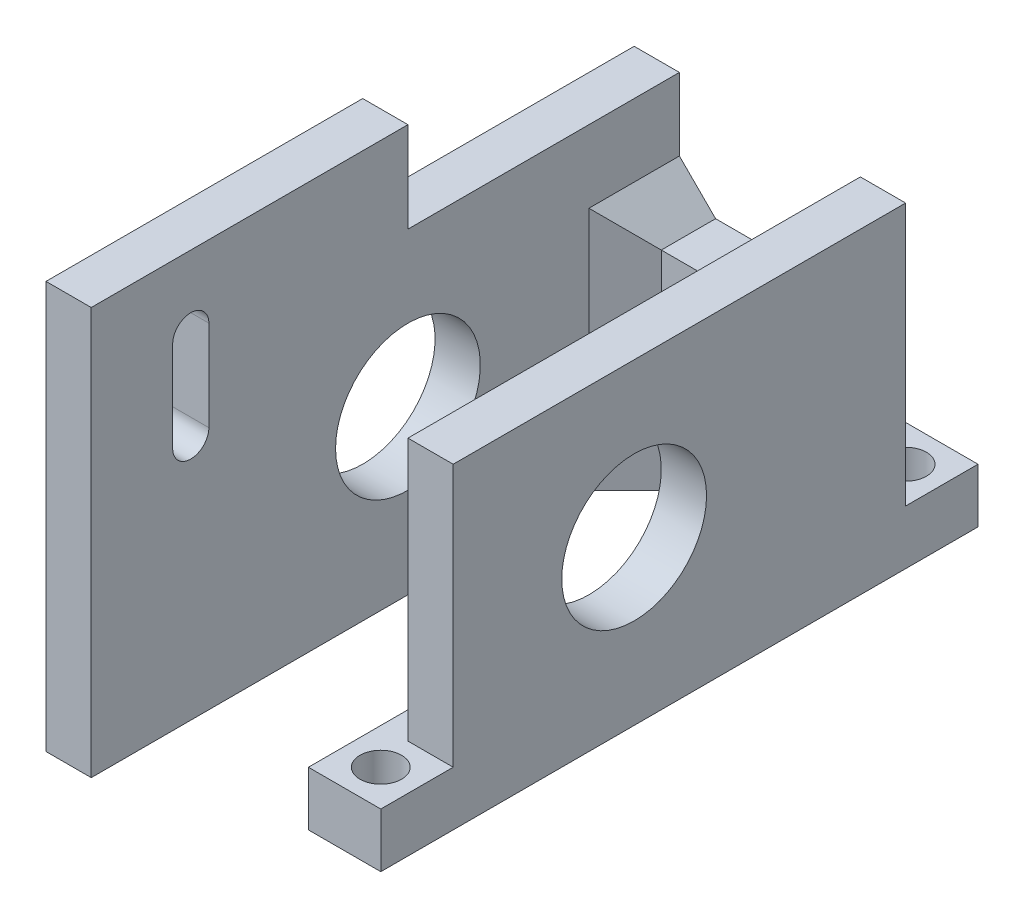
from build123d import *

# Parameters (mm, degrees)
BOSS_EXTRU_1_DEPTH      = 35
BOSS_EXTRU_7_DEPTH      = 8
ESQUISSE1_8_W           = 8
ESQUISSE1_8_H           = 8
ESQUISSE1_8_R           = 2.3
BOSS_EXTRU_8_DEPTH      = 6
BOSS_EXTRU_9_DEPTH      = 35
ESQUISSE8_R             = 8
ENL_V_MAT_EXTRU_6_DEPTH = 50
ENL_V_MAT_EXTRU_5_DEPTH = 35
BOSS_EXTRU_10_DEPTH     = 5
ENL_V_MAT_EXTRU_7_DEPTH = 5


with BuildPart() as part:
    # Esquisse1 → Boss.-Extru.1 (new body)
    with BuildSketch(Plane(origin=(0, 0, 0), x_dir=(1, 0, 0), z_dir=(0, 1, 0))):
        Polygon((-18, 9), (-23, 9), (-23, 3), (-23, 1), (-23, -33), (-23, -41), (-18, -41), (-18, 3), (2, 3), (2, -37), (2, -41), (7, -41), (7, 3), (7, 9), (2, 9), (-1, 9), align=None)
    extrude(amount=BOSS_EXTRU_1_DEPTH)

    # Esquisse1<6> → Boss.-Extru.7 (add)
    with BuildSketch(Plane(origin=(0, 0, 0), x_dir=(1, 0, 0), z_dir=(0, 1, 0))):
        Polygon((-18, 9), (-23, 9), (-23, 3), (-23, 1), (-23, -33), (-23, -41), (-18, -41), (-18, 3), (2, 3), (2, -37), (2, -41), (7, -41), (7, 3), (7, 9), (2, 9), (-1, 9), align=None)
    extrude(amount=BOSS_EXTRU_7_DEPTH)

    # Esquisse1<8> → Boss.-Extru.8 (add)
    # profile 1 of 4: a face of its own
    with BuildSketch(Plane(origin=(0, 0, 0), x_dir=(1, 0, 0), z_dir=(0, 1, 0))):
        with Locations((-27, 5)):
            Rectangle(ESQUISSE1_8_W, ESQUISSE1_8_H)
        with Locations((-27, 5)):
            Circle(ESQUISSE1_8_R, mode=Mode.SUBTRACT)
    # profile 2 of 4: a face of its own
    with BuildSketch(Plane(origin=(0, 0, 0), x_dir=(1, 0, 0), z_dir=(0, 1, 0))):
        with Locations((3, 13)):
            Rectangle(ESQUISSE1_8_W, ESQUISSE1_8_H)
        with Locations((3, 13)):
            Circle(ESQUISSE1_8_R, mode=Mode.SUBTRACT)
    # profile 3 of 4: a face of its own
    with BuildSketch(Plane(origin=(0, 0, 0), x_dir=(1, 0, 0), z_dir=(0, 1, 0))):
        with Locations((-27, -37)):
            Rectangle(ESQUISSE1_8_W, ESQUISSE1_8_H)
        with Locations((-27, -37)):
            Circle(ESQUISSE1_8_R, mode=Mode.SUBTRACT)
    # profile 4 of 4: a face of its own
    with BuildSketch(Plane(origin=(0, 0, 0), x_dir=(1, 0, 0), z_dir=(0, 1, 0))):
        Polygon((7, -49), (7, -41), (2, -41), (2, -37), (-1, -37), (-1, -49), align=None)
        with Locations((3, -45)):
            Circle(ESQUISSE1_8_R, mode=Mode.SUBTRACT)
    extrude(amount=BOSS_EXTRU_8_DEPTH)

    # Esquisse6 → Boss.-Extru.9 (add)
    with BuildSketch(Plane.XZ):
        Polygon((-18, -3), (-14, -3), (-18, 1), align=None)
        Polygon((2, -3), (-2, -3), (2, 1), align=None)
    extrude(amount=-BOSS_EXTRU_9_DEPTH)

    # Esquisse8 → Enlèv. mat.-Extru.6 (cut)
    with BuildSketch(Plane.ZY.offset(23)):
        with Locations((21, 18)):
            Circle(ESQUISSE8_R)
    extrude(amount=-ENL_V_MAT_EXTRU_6_DEPTH, mode=Mode.SUBTRACT)

    # Esquisse7 → Enlèv. mat.-Extru.5 (cut)
    with BuildSketch(Plane(origin=(0, 0, -9), x_dir=(-1, 0, 0), z_dir=(0, 0, -1))):
        Polygon((18, 35), (-2, 35), (-2, 27), (2, 23), (14, 23), (18, 27), align=None)
    extrude(amount=-ENL_V_MAT_EXTRU_5_DEPTH, mode=Mode.SUBTRACT)

    # Esquisse9 → Boss.-Extru.10 (add)
    with BuildSketch(Plane.ZY.offset(23)):
        Polygon((56, 0), (56, 45), (21, 45), (21, 35), (41, 35), (41, 0), align=None)
    extrude(amount=-BOSS_EXTRU_10_DEPTH)

    # Esquisse10 → Enlèv. mat.-Extru.7 (cut)
    with BuildSketch(Plane.ZY.offset(23)):
        with BuildLine():
            Line((47, 27), (47, 37))
            ThreePointArc((47, 37), (45, 39), (43, 37))
            Line((43, 37), (43, 27))
            ThreePointArc((43, 27), (45, 25), (47, 27))
        make_face()
    extrude(amount=-ENL_V_MAT_EXTRU_7_DEPTH, mode=Mode.SUBTRACT)


solid = part.part
